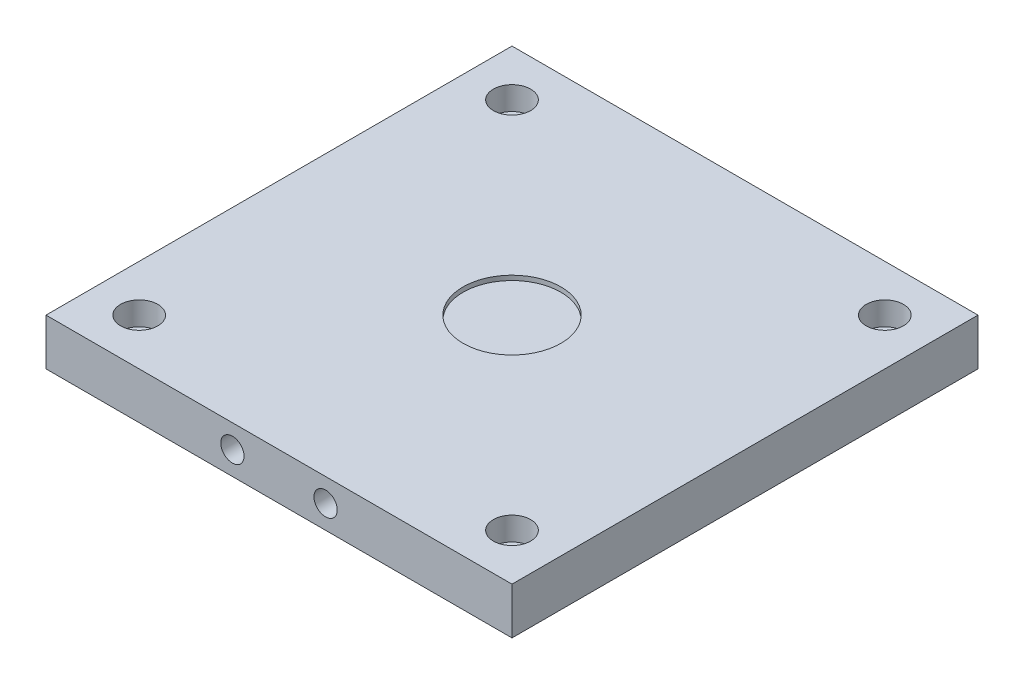
from build123d import *

# Parameters (mm, degrees)
SKETCH1_W           = 100
SKETCH1_H           = 100
BASE_DEPTH          = 10
SKETCH2_R           = 10.5
LOAD_CELL_CUT_DEPTH = 1
CUT_EXTRUDE1_REACH  = 73.414
SKETCH15_R          = 3
SKETCH21_R          = 2.5
CUT_EXTRUDE2_DEPTH  = 10
SKETCH22_R          = 4
CUT_EXTRUDE3_DEPTH  = 5


with BuildPart() as part:
    # Sketch1 → base (new body)
    with BuildSketch(Plane(origin=(0, 0, 0), x_dir=(1, 0, 0), z_dir=(0, 1, 0))):
        Rectangle(SKETCH1_W, SKETCH1_H)
    extrude(amount=BASE_DEPTH)

    # Sketch2 → load cell cut (cut)
    with BuildSketch(Plane(origin=(0, 10, 0), x_dir=(1, 0, 0), z_dir=(0, 1, 0))):
        Circle(SKETCH2_R)
    extrude(amount=-LOAD_CELL_CUT_DEPTH, mode=Mode.SUBTRACT)

    # Sketch15 → Cut-Extrude1 (cut, up to next)
    with BuildSketch(Plane(origin=(0, 0, 0), x_dir=(-1, 0, 0), z_dir=(0, -1, 0)), mode=Mode.PRIVATE) as cut_extrude1_sk1:
        with Locations((40, -40)):
            Circle(SKETCH15_R)
    cut_extrude1_tool1 = extrude(cut_extrude1_sk1.sketch, amount=-CUT_EXTRUDE1_REACH, mode=Mode.PRIVATE) & part.part
    # Sketch15 → Cut-Extrude1 (cut, up to next)
    with BuildSketch(Plane(origin=(0, 0, 0), x_dir=(-1, 0, 0), z_dir=(0, -1, 0)), mode=Mode.PRIVATE) as cut_extrude1_sk2:
        with Locations((-40, -40)):
            Circle(SKETCH15_R)
    cut_extrude1_tool2 = extrude(cut_extrude1_sk2.sketch, amount=-CUT_EXTRUDE1_REACH, mode=Mode.PRIVATE) & part.part
    # Sketch15 → Cut-Extrude1 (cut, up to next)
    with BuildSketch(Plane(origin=(0, 0, 0), x_dir=(-1, 0, 0), z_dir=(0, -1, 0)), mode=Mode.PRIVATE) as cut_extrude1_sk3:
        with Locations((40, 40)):
            Circle(SKETCH15_R)
    cut_extrude1_tool3 = extrude(cut_extrude1_sk3.sketch, amount=-CUT_EXTRUDE1_REACH, mode=Mode.PRIVATE) & part.part
    # Sketch15 → Cut-Extrude1 (cut, up to next)
    with BuildSketch(Plane(origin=(0, 0, 0), x_dir=(-1, 0, 0), z_dir=(0, -1, 0)), mode=Mode.PRIVATE) as cut_extrude1_sk4:
        with Locations((-40, 40)):
            Circle(SKETCH15_R)
    cut_extrude1_tool4 = extrude(cut_extrude1_sk4.sketch, amount=-CUT_EXTRUDE1_REACH, mode=Mode.PRIVATE) & part.part
    add(cut_extrude1_tool1.solids().sort_by_distance((-40, 0, 40))[0], mode=Mode.SUBTRACT)
    add(cut_extrude1_tool2.solids().sort_by_distance((40, 0, 40))[0], mode=Mode.SUBTRACT)
    add(cut_extrude1_tool3.solids().sort_by_distance((-40, 0, -40))[0], mode=Mode.SUBTRACT)
    add(cut_extrude1_tool4.solids().sort_by_distance((40, 0, -40))[0], mode=Mode.SUBTRACT)

    # Sketch21 → Cut-Extrude2 (cut)
    with BuildSketch(Plane(origin=(0, 0, -50), x_dir=(-1, 0, 0), z_dir=(0, 0, -1))):
        with Locations((-10, 5)):
            Circle(SKETCH21_R)
        with Locations((10, 5)):
            Circle(SKETCH21_R)
    cut_extrude2 = extrude(amount=-CUT_EXTRUDE2_DEPTH, mode=Mode.SUBTRACT)

    # Mirror2: Cut-Extrude2 across plane
    add(cut_extrude2.mirror(Plane.XY), mode=Mode.SUBTRACT)

    # Sketch22 → Cut-Extrude3 (cut)
    with BuildSketch(Plane(origin=(0, 10, 0), x_dir=(1, 0, 0), z_dir=(0, 1, 0))):
        with Locations((40, -40)):
            Circle(SKETCH22_R)
        with Locations((-40, -40)):
            Circle(SKETCH22_R)
        with Locations((-40, 40)):
            Circle(SKETCH22_R)
        with Locations((40, 40)):
            Circle(SKETCH22_R)
    extrude(amount=-CUT_EXTRUDE3_DEPTH, mode=Mode.SUBTRACT)


solid = part.part
